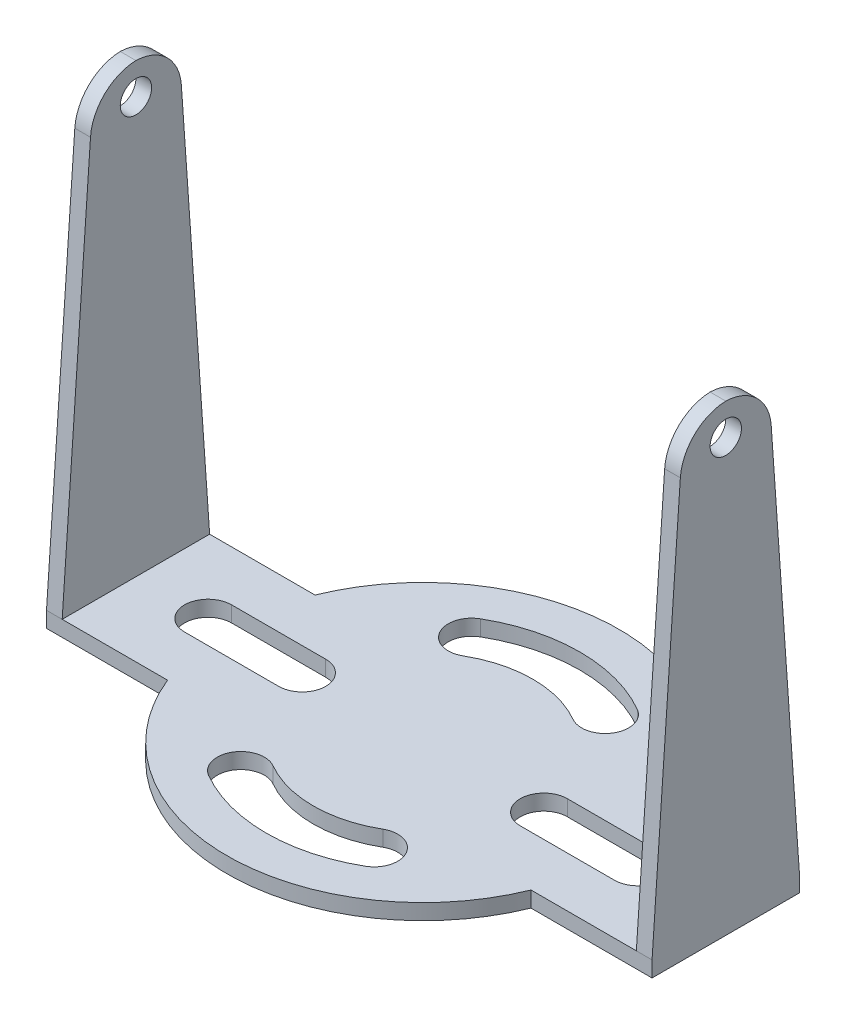
from build123d import *

# Parameters (mm, degrees)
SKETCH_2_W          = 38.6
SKETCH_2_H          = 9.4
EXTRUDE_1_DEPTH     = 1
SKETCH_3_W          = 1
SKETCH_3_H          = 9.4
EXTRUDE_2_DEPTH     = 28.5
SKETCH_4_R          = 12.5
EXTRUDE_3_DEPTH     = 1
CUT_EXTRUDE_1_DEPTH = 37.619530308
CUT_EXTRUDE_2_DEPTH = 51.164329957
SKETCH_7_R          = 1
CUT_EXTRUDE_3_DEPTH = 51.164329957
FILLET_1_R          = 3


with BuildPart() as part:
    # 草图2 → 凸台-拉伸1 (new body)
    with BuildSketch(Plane(origin=(0, 0, 0), x_dir=(1, 0, 0), z_dir=(0, 1, 0))):
        Rectangle(SKETCH_2_W, SKETCH_2_H)
    extrude(amount=EXTRUDE_1_DEPTH)

    # 草图3 → 凸台-拉伸2 (add)
    with BuildSketch(Plane(origin=(0, 1, 0), x_dir=(1, 0, 0), z_dir=(0, 1, 0))):
        with Locations((-18.8, 0)):
            Rectangle(SKETCH_3_W, SKETCH_3_H)
        with Locations((18.8, 0)):
            Rectangle(SKETCH_3_W, SKETCH_3_H)
    extrude(amount=EXTRUDE_2_DEPTH)

    # 草图4 → 凸台-拉伸3 (add)
    with BuildSketch(Plane(origin=(0, 1, 0), x_dir=(1, 0, 0), z_dir=(0, 1, 0))):
        Circle(SKETCH_4_R)
        with BuildLine():
            ThreePointArc((5, -8.660254038), (0, -10), (-5, -8.660254038))
            ThreePointArc((-5, -8.660254038), (-5.549038106, -6.611215932), (-3.5, -6.062177826))
            ThreePointArc((-3.5, -6.062177826), (0, -7), (3.5, -6.062177826))
            ThreePointArc((3.5, -6.062177826), (5.549038106, -6.611215932), (5, -8.660254038))
        make_face(mode=Mode.SUBTRACT)
        with BuildLine():
            ThreePointArc((5, 8.660254038), (0, 10), (-5, 8.660254038))
            ThreePointArc((-5, 8.660254038), (-5.549038106, 6.611215932), (-3.5, 6.062177826))
            ThreePointArc((-3.5, 6.062177826), (0, 7), (3.5, 6.062177826))
            ThreePointArc((3.5, 6.062177826), (5.549038106, 6.611215932), (5, 8.660254038))
        make_face(mode=Mode.SUBTRACT)
    extrude(amount=-EXTRUDE_3_DEPTH)

    # 草图5 → 切除-拉伸1 (cut, through all)
    with BuildSketch(Plane(origin=(0, 1, 0), x_dir=(1, 0, 0), z_dir=(0, 1, 0))):
        with BuildLine():
            Line((13.7, -1.5), (7.7, -1.5))
            ThreePointArc((7.7, -1.5), (6.2, 0), (7.7, 1.5))
            Line((7.7, 1.5), (13.7, 1.5))
            ThreePointArc((13.7, 1.5), (15.2, 0), (13.7, -1.5))
        make_face()
        with BuildLine():
            Line((-13.7, -1.5), (-7.7, -1.5))
            ThreePointArc((-7.7, -1.5), (-6.2, 0), (-7.7, 1.5))
            Line((-7.7, 1.5), (-13.7, 1.5))
            ThreePointArc((-13.7, 1.5), (-15.2, 0), (-13.7, -1.5))
        make_face()
    extrude(amount=-CUT_EXTRUDE_1_DEPTH, mode=Mode.SUBTRACT)

    # 草图6 → 切除-拉伸2 (cut, through all)
    with BuildSketch(Plane(origin=(19.3, 0, 0), x_dir=(0, 0, -1), z_dir=(1, 0, 0))):
        Polygon((-4.7, 29.5), (-4.7, 1), (-2.7, 29.5), align=None)
        Polygon((4.7, 1), (2.7, 29.5), (4.7, 29.5), align=None)
    extrude(amount=-CUT_EXTRUDE_2_DEPTH, mode=Mode.SUBTRACT)

    # 草图7 → 切除-拉伸3 (cut, through all)
    with BuildSketch(Plane(origin=(19.3, 0, 0), x_dir=(0, 0, -1), z_dir=(1, 0, 0))):
        with Locations((0, 27.5)):
            Circle(SKETCH_7_R)
    extrude(amount=-CUT_EXTRUDE_3_DEPTH, mode=Mode.SUBTRACT)

    # 圆角1
    # the kernel refuses this fillet: 3 mm, written as the material it takes off along each edge
    with BuildSketch(Plane(origin=(-11.307871249, 29.5, -2.7), x_dir=(0, -0.9975467611004155, -0.0700032814807308), z_dir=(-1, 0, 0))) as fillet_1_piece_1:
        with BuildLine():
            CenterArc((FILLET_1_R * 0.932283833485, FILLET_1_R), FILLET_1_R, 184.014175695, 85.985824305)
            Line((-FILLET_1_R * 0.0652629276154, FILLET_1_R * 0.929996718519), (0, 0))
            Line((0, 0), (FILLET_1_R * 0.932283833485, 0))
        make_face()
    extrude(amount=14.984257502, mode=Mode.SUBTRACT)
    with BuildSketch(Plane(origin=(-11.307871249, 29.5, 2.7), x_dir=(0, -0.9975467611004155, 0.0700032814807308), z_dir=(-1, 0, 0)), Plane(origin=(26.292128751, 29.5, -2.7), x_dir=(0, 0, 1), z_dir=(-1, 0, 0)), Plane(origin=(26.292128751, 29.5, 2.7), x_dir=(0, -0.9975467611004155, 0.0700032814807308), z_dir=(-1, 0, 0))) as fillet_1_piece_2:
        with BuildLine():
            CenterArc((FILLET_1_R * 0.932283833485, -FILLET_1_R), FILLET_1_R, 90, 85.985824305)
            Line((-FILLET_1_R * 0.0652629276154, -FILLET_1_R * 0.929996718519), (0, 0))
            Line((0, 0), (FILLET_1_R * 0.932283833485, 0))
        make_face()
    extrude(amount=14.984257502, mode=Mode.SUBTRACT)


solid = part.part
